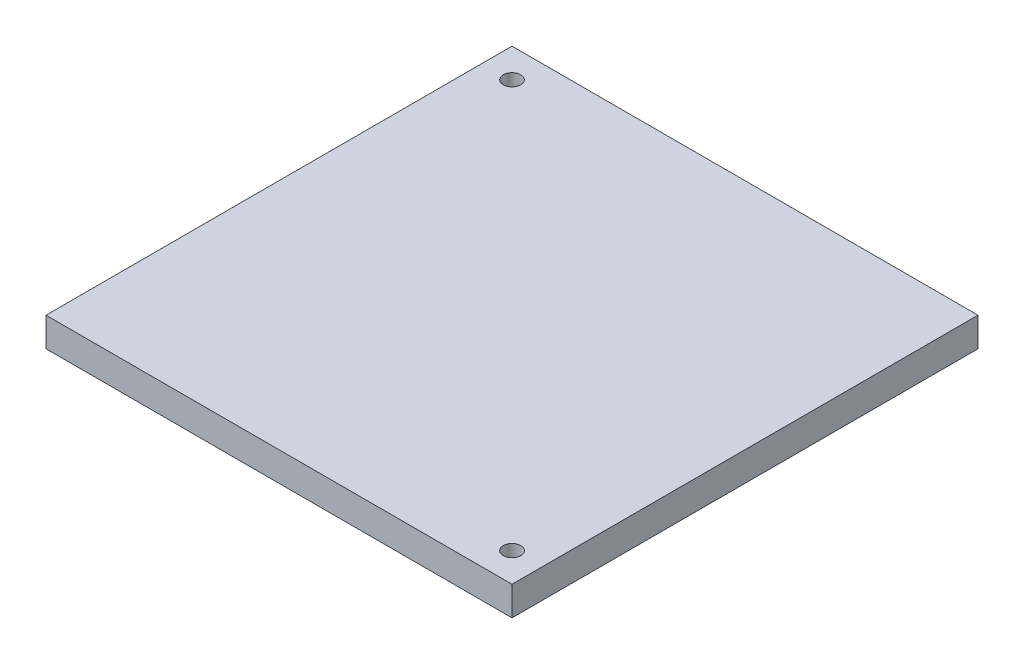
from build123d import *

# Parameters (mm, degrees)
ESQUISSE1_W             = 80
ESQUISSE1_H             = 80
BOSS_EXTRU_1_DEPTH      = 5
ESQUISSE2_R             = 1.5
ENL_V_MAT_EXTRU_1_DEPTH = 57.789083458


with BuildPart() as part:
    # Esquisse1 → Boss.-Extru.1 (new body)
    with BuildSketch(Plane(origin=(0, 0, 0), x_dir=(1, 0, 0), z_dir=(0, 1, 0))):
        Rectangle(ESQUISSE1_W, ESQUISSE1_H)
    extrude(amount=BOSS_EXTRU_1_DEPTH)

    # Esquisse2 → Enlèv. mat.-Extru.1 (cut, through all)
    with BuildSketch(Plane(origin=(0, 5, 0), x_dir=(1, 0, 0), z_dir=(0, 1, 0))):
        with Locations((-35, 35)):
            Circle(ESQUISSE2_R)
        with Locations((35, -35)):
            Circle(ESQUISSE2_R)
    extrude(amount=-ENL_V_MAT_EXTRU_1_DEPTH, mode=Mode.SUBTRACT)


solid = part.part
